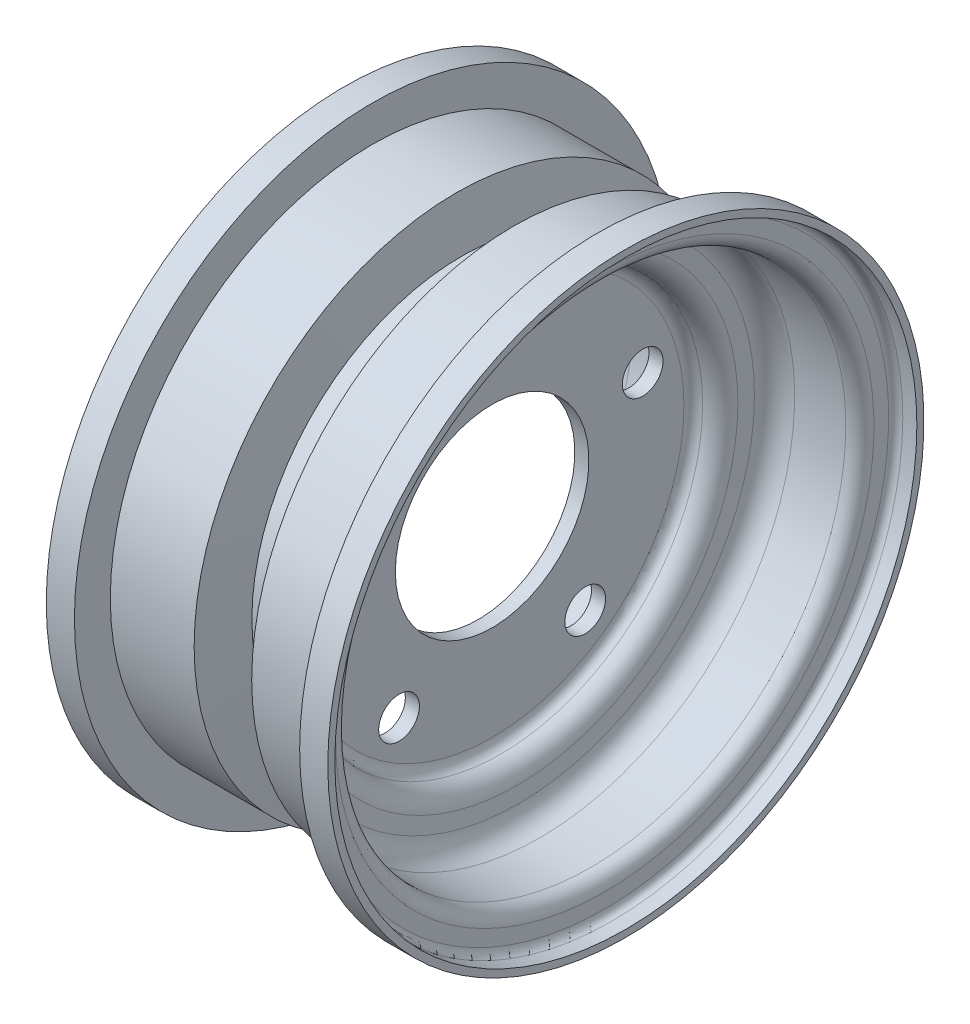
from build123d import *

# Parameters (mm, degrees)
F_37_64_0_57813_DIAMETER_HOLE1_D = 14.684502
FILLET1_R                        = 3.81
FILLET2_R                        = 7.62
FILLET3_R                        = 5.08
FILLET4_R                        = 2.54


with BuildPart() as part:
    # Sketch2 → Revolve2 (revolve)
    with BuildSketch(Plane.XY):
        Polygon((0, 34.925), (2.54, 34.925), (2.54, 73.025), (10.922, 73.025), (12.7, 92.075), (43.18, 92.075), (43.18, 105.029), (50.8, 105.029), (50.8, 107.569), (48.26, 107.569), (40.64, 107.569), (40.64, 94.615), (10.386027544, 94.615), (8.608027544, 75.565), (0, 75.565), align=None)
    revolve2 = revolve(axis=Axis((0, 0, 0), (1, 0, 0)))

    # Mirror1: Revolve2 across plane
    add(revolve2.mirror(Plane(origin=(0, 0, 0), x_dir=(0, 0, 1), z_dir=(1, 0, 0))))

    # 37/64 (0.57813) Diameter Hole1 (through all)
    with Locations(Plane(origin=(2.54, 0, 0), x_dir=(0, 0, -1), z_dir=(1, 0, 0))):
        with Locations((0, 57.15), (54.352879906, 17.660321229), (33.591927169, -46.235321229), (-33.591927169, -46.235321229), (-54.352879906, 17.660321229)):
            Hole(F_37_64_0_57813_DIAMETER_HOLE1_D / 2)

    # Fillet1
    fillet1_edges = [part.edges().sort_by_distance(p)[0] for p in [
        (2.54, -73.025, 0),
        (-2.54, -73.025, 0),
    ]]
    fillet(fillet1_edges, radius=FILLET1_R)

    # Fillet2
    fillet2_edges = [part.edges().sort_by_distance(p)[0] for p in [
        (12.7, -92.075, 0),
        (10.922, -73.025, 0),
        (-12.7, -92.075, 0),
        (-10.922, -73.025, 0),
    ]]
    fillet(fillet2_edges, radius=FILLET2_R)

    # Fillet3
    fillet3_edges = [part.edges().sort_by_distance(p)[0] for p in [
        (43.18, -92.075, 0),
        (-43.18, -92.075, 0),
    ]]
    fillet(fillet3_edges, radius=FILLET3_R)

    # Fillet4
    fillet4_edges = [part.edges().sort_by_distance(p)[0] for p in [
        (43.18, -105.029, 0),
        (-43.18, -105.029, 0),
    ]]
    fillet(fillet4_edges, radius=FILLET4_R)


solid = part.part
